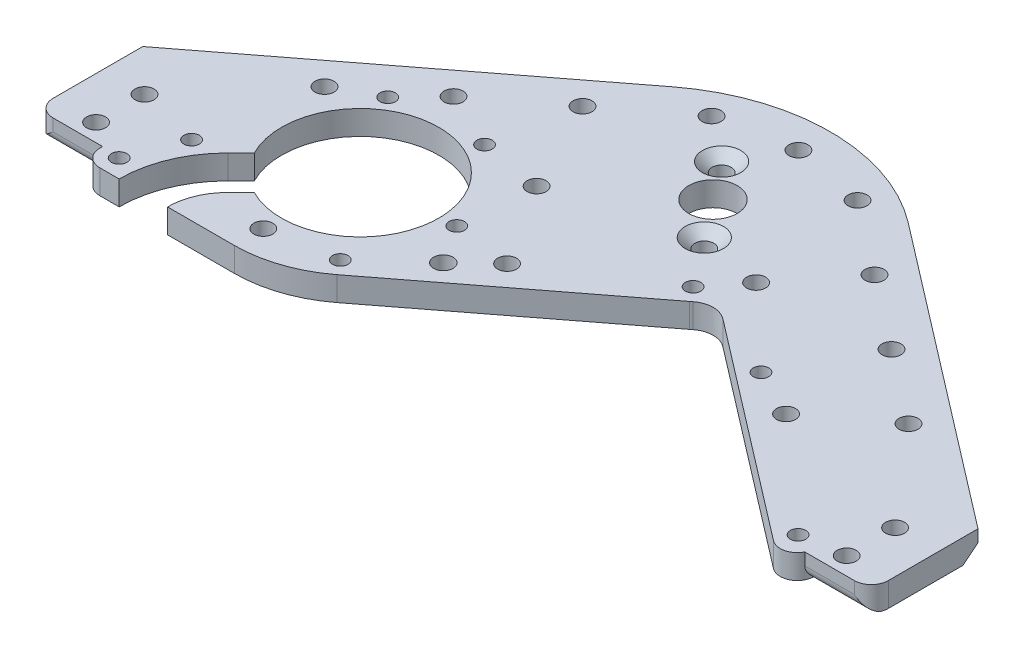
from build123d import *

# Parameters (mm, degrees)
SKETCH3_R                          = 20.6375
SKETCH3_R_2                        = 6.35
BOSS_EXTRUDE1_DEPTH                = 6.35
SKETCH8_W                          = 4.7498
SKETCH8_H                          = 41.275
BOSS_EXTRUDE4_DEPTH                = 6.35
SKETCH9_R                          = 2.4892
COLLAR_HOLES_DEPTH                 = 135.407879484
SKETCH10_R                         = 2.0193
SPACER_HOLES_DEPTH                 = 135.407879484
SPACER_HOLE_PATTERN_COUNT          = 5
SPACER_HOLE_PATTERN_PITCH          = 24.13
SPACER_HOLE_MIRROR_COPY_1_SKETCH_R = 2.0193
SPACER_HOLE_MIRROR_COPY_1_DEPTH    = 135.407879484
SPACER_HOLE_MIRROR_COPY_2_SKETCH_R = 2.0193
SPACER_HOLE_MIRROR_COPY_2_DEPTH    = 135.407879484
SPACER_HOLE_MIRROR_COPY_3_SKETCH_R = 2.0193
SPACER_HOLE_MIRROR_COPY_3_DEPTH    = 135.407879484
SPACER_HOLE_MIRROR_COPY_4_SKETCH_R = 2.0193
SPACER_HOLE_MIRROR_COPY_4_DEPTH    = 135.407879484
SPACER_HOLE_MIRROR_COPY_5_SKETCH_R = 2.0193
SPACER_HOLE_MIRROR_COPY_5_DEPTH    = 135.407879484
SKETCH16_R                         = 2.0193
CUSTOM_NUTSTRIP_HOLES_DEPTH        = 135.407879484
SKETCH36_R                         = 2.0193
AUX_SPACER_HOLES_DEPTH             = 135.407879484
SKETCH49_R                         = 2.0193
CUT_EXTRUDE23_DEPTH                = 135.407879484
SKETCH50_R                         = 2.0193
CUT_EXTRUDE24_DEPTH                = 135.407879484
SKETCH58_R                         = 2.0193
CUT_EXTRUDE30_DEPTH                = 135.407879484
SKETCH11_R                         = 2.4892
ENLARGE_SPACER_HOLES_DEPTH         = 135.407879484
TOP_CHAMFER_SIZE                   = 2.54
CUT_EXTRUDE34_DEPTH                = 135.407879484
CUT_EXTRUDE52_DEPTH                = 135.407879484
SKETCH110_W                        = 17.4498
SKETCH110_H                        = 9.652
CUT_EXTRUDE56_DEPTH                = 135.407879484
CHAMFER4_SIZE                      = 3.175
FILLET21_R                         = 6.35
FILLET41_R                         = 4.445
FILLET45_R                         = 3.175
SKETCH112_R                        = 2.5527
CUT_EXTRUDE57_DEPTH                = 132.882623246


with BuildPart() as part:
    # Sketch3 → Boss-Extrude1 (new body)
    with BuildSketch(Plane(origin=(0, 25.4, 0), x_dir=(1, 0, 0), z_dir=(0, 1, 0))):
        with BuildLine():
            Line((-104.775, -36.374686106), (-30.925080594, 20.292350114))
            Line((-30.925080594, 20.292350114), (0, 44.021999059))
            Line((0, 44.021999059), (30.925080594, 20.292350114))
            Line((30.925080594, 20.292350114), (104.775, -36.374686106))
            Line((104.775, -36.374686106), (104.775, -77.649686106))
            Line((104.775, -77.649686106), (92.075, -77.649686106))
            Line((92.075, -77.649686106), (92.075, -74.653632333))
            Line((92.075, -74.653632333), (24.142327736, -22.527059539))
            ThreePointArc((24.142327736, -22.527059539), (22.197769032, -24.445438225), (20.101302386, -26.196527296))
            Line((20.101302386, -26.196527296), (-32.251449857, -66.368206988))
            ThreePointArc((-32.251449857, -66.368206988), (-41.738821099, -71.439312567), (-52.352752243, -73.191679691))
            Line((-52.352752243, -73.191679691), (-92.075, -73.191679691))
            Line((-92.075, -73.191679691), (-92.075, -77.649686106))
            Line((-92.075, -77.649686106), (-104.775, -77.649686106))
            Line((-104.775, -77.649686106), (-104.775, -36.374686106))
        make_face()
        with Locations(Location((-52.352752243, -40.171679691, 0), (0, 0, 270))):
            Circle(SKETCH3_R, mode=Mode.SUBTRACT)
        with Locations(Location((0, 0, 0), (0, 0, 270))):
            Circle(SKETCH3_R_2, mode=Mode.SUBTRACT)
    extrude(amount=-BOSS_EXTRUDE1_DEPTH)

    # Sketch8 → Boss-Extrude4 (add, through all)
    with BuildSketch(Plane(origin=(0, 25.4, 0), x_dir=(1, 0, 0), z_dir=(0, 1, 0))):
        with Locations((-107.1499, -57.012186106)):
            Rectangle(SKETCH8_W, SKETCH8_H)
        with Locations((107.1499, -57.012186106)):
            Rectangle(SKETCH8_W, SKETCH8_H)
    extrude(amount=-BOSS_EXTRUDE4_DEPTH)

    # Sketch9 → Collar Holes (cut, through all)
    with BuildSketch(Plane(origin=(0, 25.4, 0), x_dir=(1, 0, 0), z_dir=(0, 1, 0))):
        with Locations(Location((-7.491600774, 9.763244212, 0), (0, 0, 270))):
            Circle(SKETCH9_R)
        with Locations(Location((7.491600774, -9.763244212, 0), (0, 0, 270))):
            Circle(SKETCH9_R)
    extrude(amount=-COLLAR_HOLES_DEPTH, mode=Mode.SUBTRACT)

    # Sketch10 → Spacer Holes (cut, through all)
    with BuildSketch(Plane(origin=(0, 25.4, 0), x_dir=(1, 0, 0), z_dir=(0, 1, 0))):
        with Locations(Location((0, 33.456719285, 0), (0, 0, 270))):
            Circle(SKETCH10_R)
    spacer_holes = extrude(amount=-SPACER_HOLES_DEPTH, mode=Mode.SUBTRACT)

    # Spacer Hole Pattern: Spacer Holes ×5
    with Locations(*[Vector(-0.7933533402912316, 0, 0.6087614290087253) * (i * SPACER_HOLE_PATTERN_PITCH) for i in range(1, SPACER_HOLE_PATTERN_COUNT)]):
        add(spacer_holes, mode=Mode.SUBTRACT)

    # Spacer Hole Mirror copy 1 sketch → Spacer Hole Mirror copy 1 (cut, through all)
    with BuildSketch(Plane(origin=(19.143616101, 25.4, 14.689413282), x_dir=(-1, 0, 0), z_dir=(0, 1, 0))):
        with Locations((0, -33.456719285)):
            Circle(SPACER_HOLE_MIRROR_COPY_1_SKETCH_R)
    extrude(amount=-SPACER_HOLE_MIRROR_COPY_1_DEPTH, mode=Mode.SUBTRACT)

    # Spacer Hole Mirror copy 2 sketch → Spacer Hole Mirror copy 2 (cut, through all)
    with BuildSketch(Plane(origin=(38.287232202, 25.4, 29.378826564), x_dir=(-1, 0, 0), z_dir=(0, 1, 0))):
        with Locations((0, -33.456719285)):
            Circle(SPACER_HOLE_MIRROR_COPY_2_SKETCH_R)
    extrude(amount=-SPACER_HOLE_MIRROR_COPY_2_DEPTH, mode=Mode.SUBTRACT)

    # Spacer Hole Mirror copy 3 sketch → Spacer Hole Mirror copy 3 (cut, through all)
    with BuildSketch(Plane(origin=(57.430848304, 25.4, 44.068239846), x_dir=(-1, 0, 0), z_dir=(0, 1, 0))):
        with Locations((0, -33.456719285)):
            Circle(SPACER_HOLE_MIRROR_COPY_3_SKETCH_R)
    extrude(amount=-SPACER_HOLE_MIRROR_COPY_3_DEPTH, mode=Mode.SUBTRACT)

    # Spacer Hole Mirror copy 4 sketch → Spacer Hole Mirror copy 4 (cut, through all)
    with BuildSketch(Plane(origin=(76.574464405, 25.4, 58.757653128), x_dir=(-1, 0, 0), z_dir=(0, 1, 0))):
        with Locations((0, -33.456719285)):
            Circle(SPACER_HOLE_MIRROR_COPY_4_SKETCH_R)
    extrude(amount=-SPACER_HOLE_MIRROR_COPY_4_DEPTH, mode=Mode.SUBTRACT)

    # Spacer Hole Mirror copy 5 sketch → Spacer Hole Mirror copy 5 (cut, through all)
    with BuildSketch(Plane(origin=(0, 25.4, 0), x_dir=(-1, 0, 0), z_dir=(0, 1, 0))):
        with Locations((0, -33.456719285)):
            Circle(SPACER_HOLE_MIRROR_COPY_5_SKETCH_R)
    extrude(amount=-SPACER_HOLE_MIRROR_COPY_5_DEPTH, mode=Mode.SUBTRACT)

    # Sketch16 → Custom Nutstrip Holes (cut, through all)
    with BuildSketch(Plane(origin=(0, 25.4, 0), x_dir=(1, 0, 0), z_dir=(0, 1, 0))):
        with Locations(Location((-98.425, -50.662186106, 0), (0, 0, 270))):
            Circle(SKETCH16_R)
        with Locations(Location((-98.425, -63.362186106, 0), (0, 0, 270))):
            Circle(SKETCH16_R)
        with Locations(Location((98.425, -63.362186106, 0), (0, 0, 90))):
            Circle(SKETCH16_R)
        with Locations(Location((98.425, -50.662186106, 0), (0, 0, 90))):
            Circle(SKETCH16_R)
    extrude(amount=-CUSTOM_NUTSTRIP_HOLES_DEPTH, mode=Mode.SUBTRACT)

    # Sketch36 → Aux Spacer Holes (cut, through all)
    with BuildSketch(Plane(origin=(0, 25.4, 0), x_dir=(1, 0, 0), z_dir=(0, 1, 0))):
        with Locations(Location((-52.352752243, -65.571679691, 0), (0, 0, 270))):
            Circle(SKETCH36_R)
        with Locations(Location((58.293943402, -39.127716128, 0), (0, 0, 270))):
            Circle(SKETCH36_R)
        with Locations(Location((24.512886804, -13.206599718, 0), (0, 0, 270))):
            Circle(SKETCH36_R)
        with Locations(Location((-12.439980265, -41.561531903, 0), (0, 0, 270))):
            Circle(SKETCH36_R)
        with Locations(Location((-26.176376122, -20.085839846, 0), (0, 0, 270))):
            Circle(SKETCH36_R)
    extrude(amount=-AUX_SPACER_HOLES_DEPTH, mode=Mode.SUBTRACT)

    # Sketch49 → Cut-Extrude23 (cut, through all)
    with BuildSketch(Plane(origin=(0, 25.4, 0), x_dir=(1, 0, 0), z_dir=(0, 1, 0))):
        with Locations(Location((-81.967180737, -54.776679691, 0), (0, 0, 270))):
            Circle(SKETCH49_R)
        with Locations(Location((-65.875779659, -19.424801504, 0), (0, 0, 270))):
            Circle(SKETCH49_R)
        with Locations(Location((-42.422737009, -17.484678513, 0), (0, 0, 270))):
            Circle(SKETCH49_R)
        with Locations(Location((-27.594740634, -39.583388821, 0), (0, 0, 270))):
            Circle(SKETCH49_R)
    extrude(amount=-CUT_EXTRUDE23_DEPTH, mode=Mode.SUBTRACT)

    # Sketch50 → Cut-Extrude24 (cut, through all)
    with BuildSketch(Plane(origin=(0, 25.4, 0), x_dir=(1, 0, 0), z_dir=(0, 1, 0))):
        with Locations(Location((-87.3125, -68.429179691, 0), (0, 0, 270))):
            Circle(SKETCH50_R)
        with Locations(Location((-35.150676163, -62.589861704, 0), (0, 0, 270))):
            Circle(SKETCH50_R)
        with Locations(Location((17.20207608, -22.418182013, 0), (0, 0, 270))):
            Circle(SKETCH50_R)
        with Locations(Location((45.531325629, -32.936414996, 0), (0, 0, 270))):
            Circle(SKETCH50_R)
        with Locations(Location((87.3125, -64.996237681, 0), (0, 0, 270))):
            Circle(SKETCH50_R)
    extrude(amount=-CUT_EXTRUDE24_DEPTH, mode=Mode.SUBTRACT)

    # Sketch58 → Cut-Extrude30 (cut, through all)
    with BuildSketch(Plane(origin=(0, 25.4, 0), x_dir=(1, 0, 0), z_dir=(0, 1, 0))):
        with Locations(Location((0, 22.408000428, 0), (0, 0, 270))):
            Circle(SKETCH58_R)
        with BuildLine():
            Line((-30.925080594, 20.292350114), (0, 44.021999059))
            Line((0, 44.021999059), (30.925080594, 20.292350114))
            ThreePointArc((30.925080594, 20.292350114), (0, 30.790000428), (-30.925080594, 20.292350114))
        make_face()
    extrude(amount=-CUT_EXTRUDE30_DEPTH, mode=Mode.SUBTRACT)

    # Sketch11 → Enlarge Spacer Holes (cut, through all)
    with BuildSketch(Plane(origin=(0, 25.4, 0), x_dir=(1, 0, 0), z_dir=(0, 1, 0))):
        with Locations(Location((0, 22.408000428, 0), (0, 0, 270))):
            Circle(SKETCH11_R)
        with Locations(Location((-76.574464405, -25.300933843, 0), (0, 0, 270))):
            Circle(SKETCH11_R)
        with Locations(Location((-57.430848304, -10.611520561, 0), (0, 0, 270))):
            Circle(SKETCH11_R)
        with Locations(Location((-38.287232202, 4.077892721, 0), (0, 0, 270))):
            Circle(SKETCH11_R)
        with Locations(Location((-19.143616101, 18.767306003, 0), (0, 0, 270))):
            Circle(SKETCH11_R)
        with Locations(Location((19.143616101, 18.767306003, 0), (0, 0, 270))):
            Circle(SKETCH11_R)
        with Locations(Location((38.287232202, 4.077892721, 0), (0, 0, 270))):
            Circle(SKETCH11_R)
        with Locations(Location((57.430848304, -10.611520561, 0), (0, 0, 270))):
            Circle(SKETCH11_R)
        with Locations(Location((76.574464405, -25.300933843, 0), (0, 0, 270))):
            Circle(SKETCH11_R)
        with Locations(Location((-52.352752243, -65.571679691, 0), (0, 0, 270))):
            Circle(SKETCH11_R)
        with Locations(Location((-98.425, -50.662186106, 0), (0, 0, 270))):
            Circle(SKETCH11_R)
        with Locations(Location((-98.425, -63.362186106, 0), (0, 0, 270))):
            Circle(SKETCH11_R)
        with Locations(Location((98.425, -50.662186106, 0), (0, 0, 270))):
            Circle(SKETCH11_R)
        with Locations(Location((98.425, -63.362186106, 0), (0, 0, 270))):
            Circle(SKETCH11_R)
        with Locations(Location((-26.176376122, -20.085839846, 0), (0, 0, 270))):
            Circle(SKETCH11_R)
        with Locations(Location((-12.439980265, -41.561531903, 0), (0, 0, 270))):
            Circle(SKETCH11_R)
        with Locations(Location((24.512886804, -13.206599718, 0), (0, 0, 270))):
            Circle(SKETCH11_R)
        with Locations(Location((58.293943402, -39.127716128, 0), (0, 0, 270))):
            Circle(SKETCH11_R)
    extrude(amount=-ENLARGE_SPACER_HOLES_DEPTH, mode=Mode.SUBTRACT)

    # Top Chamfer
    top_chamfer_edges = [part.edges().sort_by_distance(p)[0] for p in [
        (-7.491600774, 25.4, -12.252444212),
        (7.491600774, 25.4, 7.274044212),
    ]]
    chamfer(top_chamfer_edges, length=TOP_CHAMFER_SIZE)

    # Sketch75 → Cut-Extrude34 (cut, through all)
    with BuildSketch(Plane(origin=(0, 25.4, 0), x_dir=(1, 0, 0), z_dir=(0, 1, 0))):
        Polygon((-104.775, -36.374686106), (-109.5248, -40.019335834), (-109.5248, -36.374686106), align=None)
        Polygon((104.775, -36.374686106), (109.5248, -40.019335834), (109.5248, -36.374686106), align=None)
    extrude(amount=-CUT_EXTRUDE34_DEPTH, mode=Mode.SUBTRACT)

    # Sketch101 → Cut-Extrude52 (cut, through all)
    with BuildSketch(Plane(origin=(0, 25.4, 0), x_dir=(1, 0, 0), z_dir=(0, 1, 0))):
        with BuildLine():
            Line((-61.747578382, -58.546761951), (-65.223756626, -62.022940195))
            ThreePointArc((-65.223756626, -62.022940195), (-68.64767852, -67.147201432), (-69.85, -73.191679691))
            Line((-69.85, -73.191679691), (-82.55, -73.191679691))
            ThreePointArc((-82.55, -73.191679691), (-80.380948583, -62.287121841), (-74.204012747, -53.042684074))
            Line((-74.204012747, -53.042684074), (-70.727834503, -49.56650583))
            Line((-70.727834503, -49.56650583), (-61.747578382, -58.546761951))
        make_face()
    extrude(amount=-CUT_EXTRUDE52_DEPTH, mode=Mode.SUBTRACT)

    # Sketch110 → Cut-Extrude56 (cut, through all)
    with BuildSketch(Plane(origin=(0, 25.4, 0), x_dir=(1, 0, 0), z_dir=(0, 1, 0))):
        with Locations((-100.7999, -72.823686106)):
            Rectangle(SKETCH110_W, SKETCH110_H)
        with Locations((100.7999, -72.823686106)):
            Rectangle(SKETCH110_W, SKETCH110_H)
    extrude(amount=-CUT_EXTRUDE56_DEPTH, mode=Mode.SUBTRACT)

    # Chamfer4
    chamfer4_edges = [part.edges().sort_by_distance(p)[0] for p in [
        (-70.224940297, 19.05, 9.86349286),
        (0, 19.05, -30.790000428),
        (70.224940297, 19.05, 9.86349286),
    ]]
    chamfer(chamfer4_edges, length=CHAMFER4_SIZE)

    # Fillet21
    fillet21_edges = [part.edges().sort_by_distance(p)[0] for p in [
        (24.142327736, 22.225, 22.527059539),
    ]]
    fillet(fillet21_edges, radius=FILLET21_R)

    # Fillet41
    # the kernel refuses this fillet: 4.445 mm, written as the material it takes off along each edge
    with BuildSketch(Plane(origin=(109.5248, 36.5125, 67.997686106), x_dir=(-1, 0, 0), z_dir=(0, -1, 0)), Plane(origin=(-109.5248, 36.5125, 67.997686106), x_dir=(0, 0, -1), z_dir=(0, -1, 0))) as fillet41_piece_1:
        with BuildLine():
            CenterArc((FILLET41_R, FILLET41_R), FILLET41_R, 180, 90)
            Line((0, FILLET41_R), (-FILLET41_R * 0.02, FILLET41_R))
            Line((-FILLET41_R * 0.02, FILLET41_R), (-FILLET41_R * 0.02, -FILLET41_R * 0.02))
            Line((-FILLET41_R * 0.02, -FILLET41_R * 0.02), (FILLET41_R, -FILLET41_R * 0.02))
            Line((FILLET41_R, -FILLET41_R * 0.02), (FILLET41_R, 0))
        make_face()
    extrude(amount=28.575, mode=Mode.SUBTRACT)
    with BuildSketch(Plane(origin=(92.075, 46.444130009, 74.653632333), x_dir=(-0.7933533402912316, 0, -0.6087614290087255), z_dir=(0, -1, 0))) as fillet41_piece_2:
        with BuildLine():
            CenterArc((8.417652003, 4.445), FILLET41_R, 169.165785029, 100.834214971)
            Line((4.051883336, 5.280517172), (3.964567963, 5.297227515))
            ThreePointArc((3.964567963, 5.297227515), (1.955412556, 2.694377477), (-0.070529112, 0.054118891))
            Line((-0.070529112, 0.054118891), (0, -0.0889))
            Line((0, -0.0889), (8.417652003, -0.0889))
            Line((8.417652003, -0.0889), (8.417652003, 0))
        make_face()
    extrude(amount=48.438260017, mode=Mode.SUBTRACT)
    with BuildSketch(Plane(origin=(-92.075, 36.5125, 73.191679691), x_dir=(1, 0, 0), z_dir=(0, -1, 0))) as fillet41_piece_3:
        with BuildLine():
            CenterArc((FILLET41_R, -FILLET41_R), FILLET41_R, 90, 90)
            Line((0, -FILLET41_R), (-FILLET41_R * 0.02, -FILLET41_R))
            Line((-FILLET41_R * 0.02, -FILLET41_R), (-FILLET41_R * 0.02, FILLET41_R * 0.02))
            Line((-FILLET41_R * 0.02, FILLET41_R * 0.02), (FILLET41_R, FILLET41_R * 0.02))
            Line((FILLET41_R, FILLET41_R * 0.02), (FILLET41_R, 0))
        make_face()
    extrude(amount=28.575, mode=Mode.SUBTRACT)

    # Fillet45
    # the kernel refuses this fillet: 3.175 mm, written as the material it takes off along each edge
    with BuildSketch(Plane(origin=(-113.0173, 19.05, 67.997686106), x_dir=(0, 1, 0), z_dir=(1, 0, 0))) as fillet45_piece_1:
        with BuildLine():
            CenterArc((FILLET45_R, -FILLET45_R), FILLET45_R, 90, 90)
            Line((0, -FILLET45_R), (0, 0))
            Line((0, 0), (FILLET45_R, 0))
        make_face()
    extrude(amount=20.9423, mode=Mode.SUBTRACT)
    with BuildSketch(Plane(origin=(113.0173, 19.05, 67.997686106), x_dir=(0, 1, 0), z_dir=(-1, 0, 0))) as fillet45_piece_2_section:
        with BuildLine():
            CenterArc((FILLET45_R, FILLET45_R), FILLET45_R, 180, 90)
            Line((0, FILLET45_R), (0, 0))
            Line((0, 0), (FILLET45_R, 0))
        make_face()
    fillet45_piece_2 = extrude(amount=28.8798, mode=Mode.PRIVATE)
    fillet45_piece_2 = fillet45_piece_2 - Plane(origin=(88.102772218, 19.593814114, 66.002834873), x_dir=(-0.7933533402910131, 0, -0.6087614290090101), z_dir=(0, 1, 0)) * Cylinder(4.445, 71, mode=Mode.PRIVATE)
    add(fillet45_piece_2, mode=Mode.SUBTRACT)

    # Sketch112 → Cut-Extrude57 (cut, through all)
    with BuildSketch(Plane(origin=(0, 25.4, 0), x_dir=(1, 0, 0), z_dir=(0, 1, 0))):
        with Locations(Location((-20.992912415, -49.725227534, 0), (0, 0, 270))):
            Circle(SKETCH112_R)
    extrude(amount=-CUT_EXTRUDE57_DEPTH, mode=Mode.SUBTRACT)


solid = part.part
